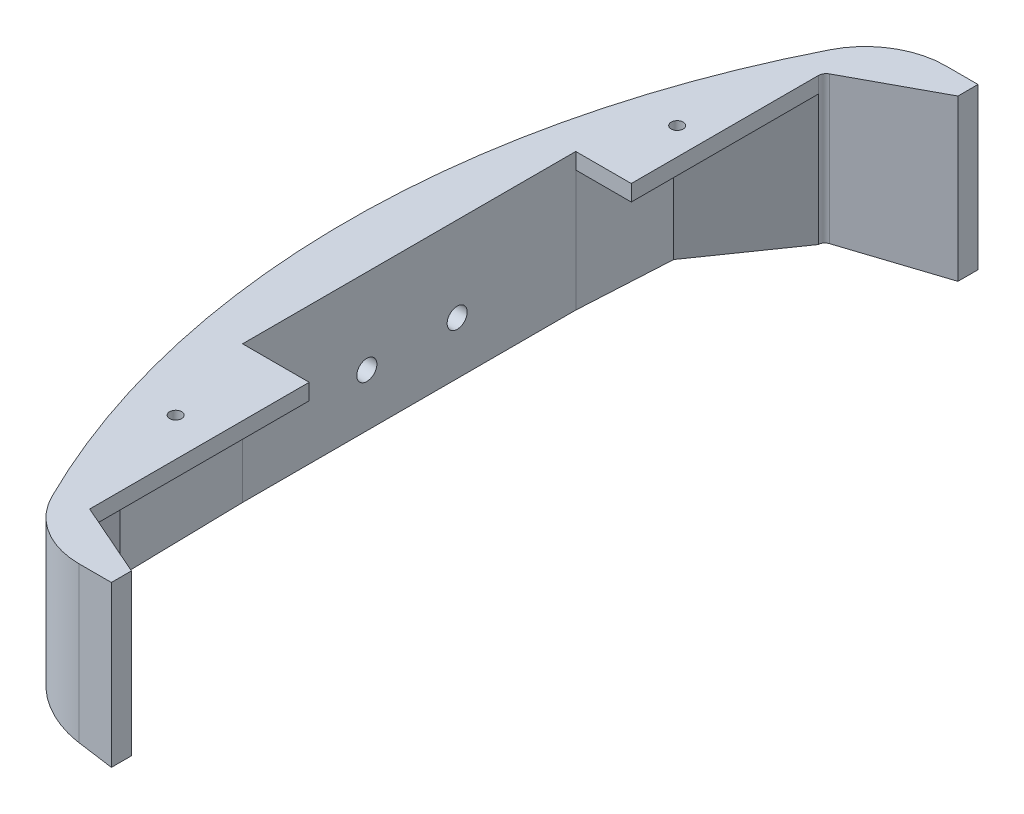
from build123d import *

# Parameters (mm, degrees)
FRONT_SKETCH_R      = 1.905
BOSS_EXTRUDE1_DEPTH = 50.8
CUT_EXTRUDE1_START  = -53.34
CUT_EXTRUDE1_DEPTH  = 48.26
CUT_EXTRUDE2_DEPTH  = 320.68422056
SKETCH3_R           = 3.175
CUT_EXTRUDE3_DEPTH  = 159.197793465


with BuildPart() as part:
    # front_sketch → Boss-Extrude1 (new body)
    with BuildSketch(Plane(origin=(0, 0, 0), x_dir=(1, 0, 0), z_dir=(0, 1, 0))):
        with BuildLine():
            Line((-94.961375831, 124.478458264), (-121.345326632, 110.234521439))
            ThreePointArc((-121.345326632, 110.234521439), (-122.32001306, 109.300728329), (-122.678671172, 107.99944144))
            Line((-122.678671172, 107.99944144), (-122.678671172, 48.810796684))
            Line((-122.678671172, 48.810796684), (-140.250849959, 48.810796684))
            Line((-140.250849959, 48.810796684), (-140.250849959, -56.645199257))
            Line((-140.250849959, -56.645199257), (-119.167015715, -56.645199257))
            Line((-119.167015715, -56.645199257), (-119.167015715, -126.112255785))
            Line((-119.167015715, -126.112255785), (-95.601645083, -136.460242597))
            Line((-95.601645083, -136.460242597), (-95.601645083, -142.810242597))
            Line((-95.601645083, -142.810242597), (-105.798207048, -142.810242597))
            ThreePointArc((-105.798207048, -142.810242597), (-119.167015715, -139.007347839), (-128.532661201, -128.737404395))
            ThreePointArc((-128.532661201, -128.737404395), (-157.286213724, -5.861503432), (-127.918775374, 116.869125935))
            ThreePointArc((-127.918775374, 116.869125935), (-118.556014486, 127.058910858), (-105.241228699, 130.828458264))
            Line((-105.241228699, 130.828458264), (-94.961375831, 130.828458264))
            Line((-94.961375831, 130.828458264), (-94.961375831, 124.478458264))
        make_face()
        with Locations((-131.296368682, 71.963600743)):
            Circle(FRONT_SKETCH_R, mode=Mode.SUBTRACT)
        with Locations((-131.296368682, -86.786399257)):
            Circle(FRONT_SKETCH_R, mode=Mode.SUBTRACT)
    extrude(amount=BOSS_EXTRUDE1_DEPTH)

    # Sketch1 → Cut-Extrude1 (cut)
    with BuildSketch(Plane(origin=(0, 50.8, 0), x_dir=(1, 0, 0), z_dir=(0, 1, 0)).offset(CUT_EXTRUDE1_START)):
        Polygon((-122.678671172, 48.810796684), (-122.678671172, 107.99944144), (-138.833286115, 78.405119062), (-140.250849959, 48.810796684), align=None)
        Polygon((-119.167015715, -56.645199257), (-140.250849959, -56.645199257), (-139.542068037, -96.192486205), (-119.167015715, -126.112255785), align=None)
    extrude(amount=CUT_EXTRUDE1_DEPTH, mode=Mode.SUBTRACT)

    # Sketch2 → Cut-Extrude2 (cut, through all)
    with BuildSketch(Plane.XY.offset(142.810242597)):
        Polygon((-94.961375831, 0), (-157.287069608, 0), (-157.287069608, 10.05650125), align=None)
    extrude(amount=-CUT_EXTRUDE2_DEPTH, mode=Mode.SUBTRACT)

    # Sketch3 → Cut-Extrude3 (cut, through all)
    with BuildSketch(Plane(origin=(-140.250849959, 0, 0), x_dir=(0, 0, -1), z_dir=(1, 0, 0))):
        with Locations((-17.312177426, 23.984839343)):
            Circle(SKETCH3_R)
        with Locations((11.274067854, 23.984839343)):
            Circle(SKETCH3_R)
    extrude(amount=-CUT_EXTRUDE3_DEPTH, mode=Mode.SUBTRACT)


solid = part.part
